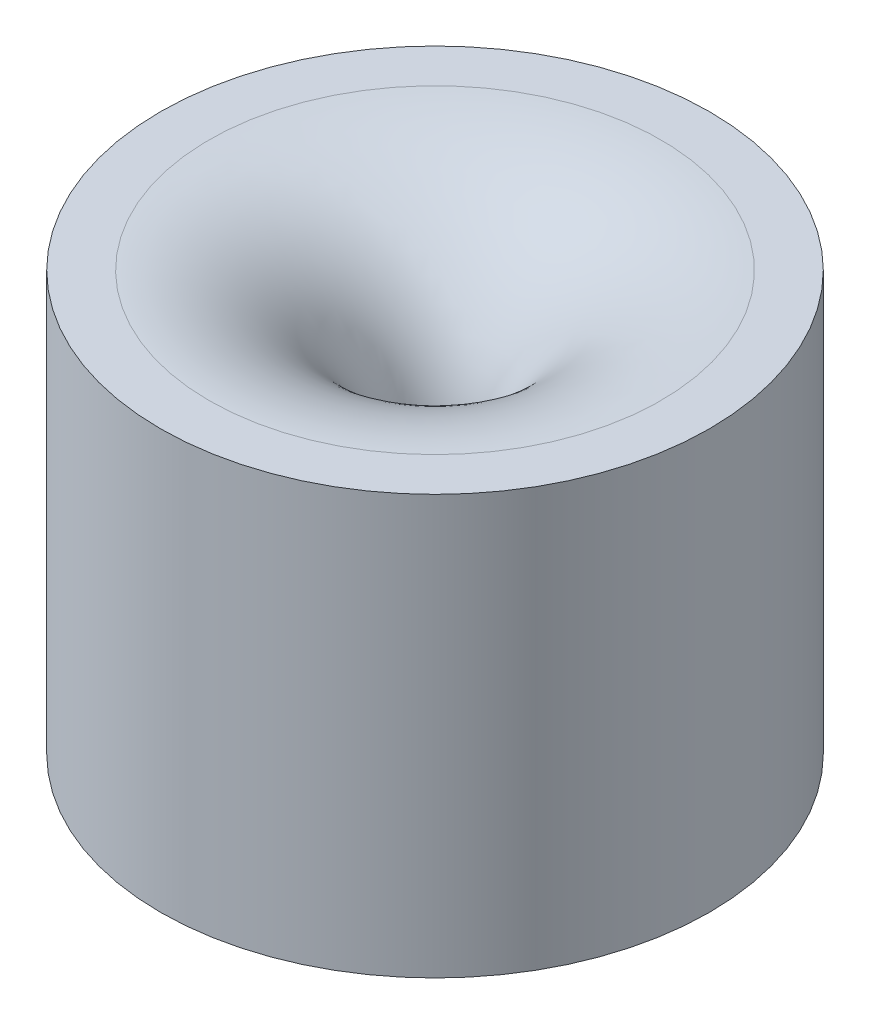
from build123d import *

# Parameters (mm, degrees)
SKETCH1_R           = 29.175
SKETCH1_R_2         = 4
BOSS_EXTRUDE1_DEPTH = 44.5
FILLET1_R           = 20
SKETCH2_R           = 11
CUT_EXTRUDE1_DEPTH  = 10


with BuildPart() as part:
    # Sketch1 → Boss-Extrude1 (new body)
    with BuildSketch(Plane(origin=(0, 0, 0), x_dir=(1, 0, 0), z_dir=(0, 1, 0))):
        Circle(SKETCH1_R)
        Circle(SKETCH1_R_2, mode=Mode.SUBTRACT)
    extrude(amount=BOSS_EXTRUDE1_DEPTH)

    # Fillet1
    fillet1_edges = [part.edges().sort_by_distance(p)[0] for p in [
        (-4, 44.5, 0),
    ]]
    fillet(fillet1_edges, radius=FILLET1_R)

    # Sketch2 → Cut-Extrude1 (cut)
    with BuildSketch(Plane.XZ):
        Circle(SKETCH2_R)
    extrude(amount=-CUT_EXTRUDE1_DEPTH, mode=Mode.SUBTRACT)


solid = part.part
